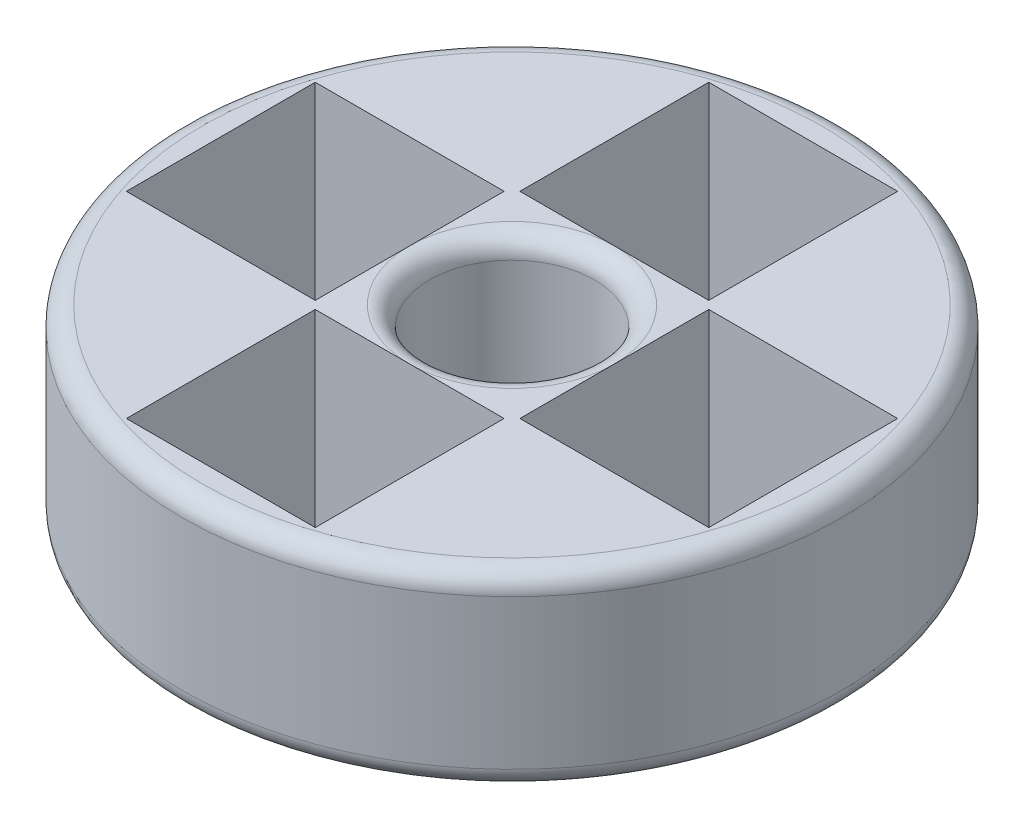
from build123d import *

# Parameters (mm, degrees)
SKIZZE1_R                       = 16.75
SKIZZE1_R_2                     = 4.2
SKIZZE1_W                       = 9.6
SKIZZE1_H                       = 9.6
AUFSATZ_LINEAR_AUSTRAGEN1_DEPTH = 9.6
VERRUNDUNG1_R                   = 1


with BuildPart() as part:
    # Skizze1 → Aufsatz-Linear austragen1 (new body)
    with BuildSketch(Plane(origin=(0, 0, 0), x_dir=(1, 0, 0), z_dir=(0, 1, 0))):
        with Locations(Location((0, 0, 0), (0, 0, 270))):
            Circle(SKIZZE1_R)
        with Locations(Location((0, 0, 0), (0, 0, 270))):
            Circle(SKIZZE1_R_2, mode=Mode.SUBTRACT)
        with Locations((0, 10)):
            Rectangle(SKIZZE1_W, SKIZZE1_H, mode=Mode.SUBTRACT)
        with Locations((10, 0)):
            Rectangle(SKIZZE1_W, SKIZZE1_H, mode=Mode.SUBTRACT)
        with Locations((0, -10)):
            Rectangle(SKIZZE1_W, SKIZZE1_H, mode=Mode.SUBTRACT)
        with Locations((-10, 0)):
            Rectangle(SKIZZE1_W, SKIZZE1_H, mode=Mode.SUBTRACT)
    extrude(amount=AUFSATZ_LINEAR_AUSTRAGEN1_DEPTH)

    # Verrundung1
    verrundung1_edges = [part.edges().sort_by_distance(p)[0] for p in [
        (0, 0, -4.2),
        (0, 9.6, -4.2),
        (0, 0, -16.75),
        (0, 9.6, -16.75),
    ]]
    fillet(verrundung1_edges, radius=VERRUNDUNG1_R - 0.0001)  # a hair under: the kernel refuses the full size


solid = part.part
